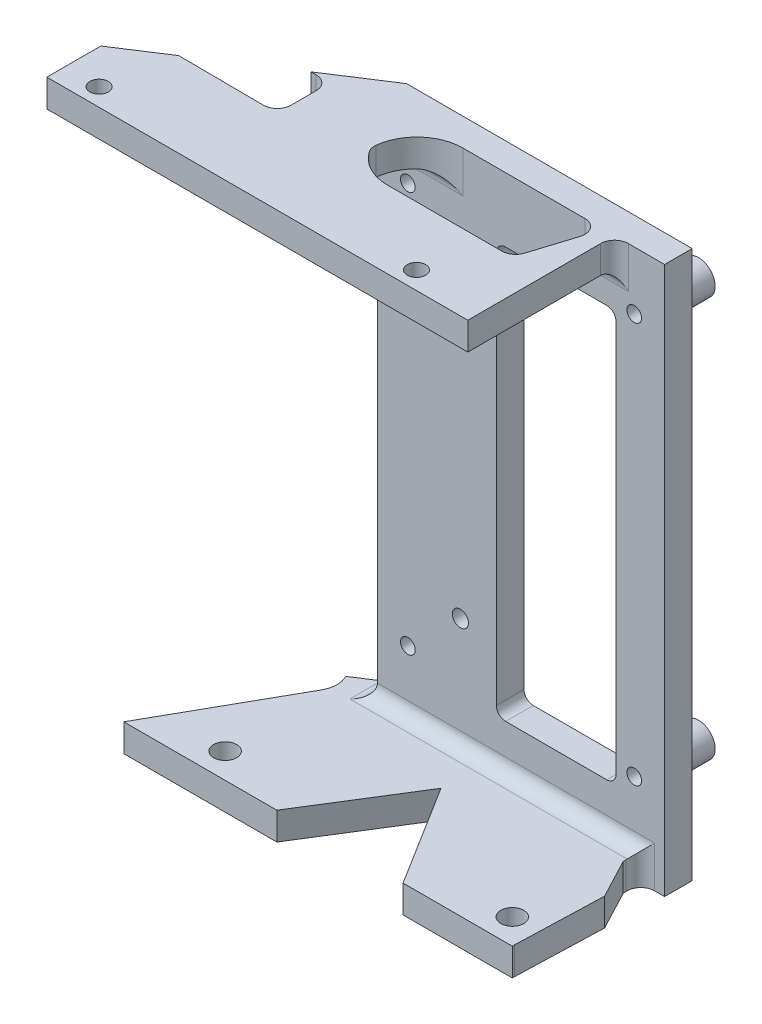
from build123d import *
from build123d.topology import SkipClean

# Parameters (mm, degrees)
SKETCH_1_R               = 3.6
SKETCH_1_R_2             = 1.6
EXTRUDE_1_DEPTH          = 3
EXTRUDE_1_2_DEPTH        = 3
EXTRUDE_1_3_DEPTH        = 3
EXTRUDE_1_4_DEPTH        = 3
EXTRUDE_1_5_DEPTH        = 3
SKETCH_2_R               = 1.6
EXTRUDE_2_DEPTH          = 6
CUT_EXTRUDE_START        = -5
CUT_EXTRUDE_1_DEPTH      = 5
EXTRUDE_START            = -6
EXTRUDE_3_DEPTH          = 6
SKETCH_12_R              = 2.5
EXTRUDE_4_DEPTH          = 6
SKETCH_13_R              = 2
EXTRUDE_5_DEPTH          = 6
SKETCH_15_W              = 58.485860782
SKETCH_15_H              = 6
EXTRUDE_7_DEPTH          = 40
SKETCH_16_R              = 2
CUT_EXTRUDE_5_DEPTH      = 40
FILLET_1_R               = 5
CUT_EXTRUDE_6_DEPTH      = 40
SKETCH_21_W              = 57.375860782
SKETCH_21_H              = 6
EXTRUDE_8_DEPTH          = 40
CUT_EXTRUDE_7_DEPTH      = 12
CUT_EXTRUDE_7_DEPTH_BACK = 26
SKETCH_24_R              = 2.5
SKETCH_25_W              = 118.615869392
SKETCH_25_H              = 27.10726564
CUT_EXTRUDE_9_DEPTH      = 130
SKETCH_26_W              = 3
SKETCH_26_H              = 7.2
CUT_EXTRUDE_10_DEPTH     = 13
CUT_EXTRUDE_11_DEPTH     = 153
EXTRUDE_9_DEPTH          = 5.999999993
CUT_EXTRUDE_12_DEPTH     = 10
EXTRUDE_START_2          = 5
SKETCH_30_R              = 3.6
SKETCH_30_R_2            = 1.6
EXTRUDE_10_DEPTH         = 5
SKETCH_31_W              = 78.686898171
SKETCH_31_H              = 6
SKETCH_31_W_2            = 101.17730892
EXTRUDE_11_DEPTH         = 15
SKETCH_32_R              = 2.5
CUT_EXTRUDE_13_DEPTH     = 15
EXTRUDE_12_DEPTH         = 3
SKETCH_35_R              = 2
CUT_EXTRUDE_14_DEPTH     = 23
SKETCH_37_W              = 101.17730892
SKETCH_37_H              = 6
SKETCH_37_W_2            = 81.686898171
EXTRUDE_13_DEPTH         = 3
CUT_EXTRUDE_15_DEPTH     = 13
CUT_EXTRUDE_16_DEPTH     = 13
CUT_EXTRUDE_17_DEPTH     = 13
CUT_EXTRUDE_18_DEPTH     = 13
SKETCH_44_R              = 1.6
EXTRUDE_14_DEPTH         = 6
SKETCH_45_R              = 1.6
EXTRUDE_15_DEPTH         = 6
SKETCH_46_R              = 1.75
CUT_EXTRUDE_20_DEPTH     = 10
CUT_EXTRUDE_21_DEPTH     = 8
SKETCH_50_W              = 128.22859335
SKETCH_50_H              = 38.015550961
CUT_EXTRUDE_22_DEPTH     = 279
SKETCH_51_W              = 42.099918758
SKETCH_51_H              = 15.171022686
CUT_EXTRUDE_26_DEPTH     = 13
CUT_EXTRUDE_27_DEPTH     = 13
FILLET_2_R               = 10
FILLET_3_R               = 10
FILLET_4_R               = 3
EXTRUDE_16_DEPTH         = 5.999999993
FILLET_5_R               = 3
FILLET_6_R               = 3
FILLET_7_R               = 3


with BuildPart() as part:
    # 草图1 → 凸台-拉伸1 (new body)
    with BuildSketch(Plane.XY):
        with Locations((-17.87, 46.890036)):
            Circle(SKETCH_1_R)
        with Locations((-17.87, 46.890036)):
            Circle(SKETCH_1_R_2, mode=Mode.SUBTRACT)
    extrude(amount=EXTRUDE_1_DEPTH)



with BuildPart() as body_2:
    # 草图1 → Extrude 1 2 (new body)
    with BuildSketch(Plane.XY):
        with Locations((31.338126, 46.890036)):
            Circle(SKETCH_1_R)
        with Locations((31.338126, 46.890036)):
            Circle(SKETCH_1_R_2, mode=Mode.SUBTRACT)
    extrude(amount=EXTRUDE_1_2_DEPTH)


with BuildPart() as body_3:
    # 草图1 → Extrude 1 3 (new body)
    with BuildSketch(Plane.XY):
        with Locations((29.0930015, 5.590791)):
            Circle(SKETCH_1_R)
        with Locations((29.0930015, 5.590791)):
            Circle(SKETCH_1_R_2, mode=Mode.SUBTRACT)
    extrude(amount=EXTRUDE_1_3_DEPTH)


with BuildPart() as body_4:
    # 草图1 → Extrude 1 4 (new body)
    with BuildSketch(Plane.XY):
        with Locations((31.338088, -40.19405)):
            Circle(SKETCH_1_R)
        with Locations((31.338088, -40.19405)):
            Circle(SKETCH_1_R_2, mode=Mode.SUBTRACT)
    extrude(amount=EXTRUDE_1_4_DEPTH)


with BuildPart() as body_5:
    # 草图1 → Extrude 1 5 (new body)
    with BuildSketch(Plane.XY):
        with BuildLine():
            Line((-17.66382396, -32.616834919), (-20.99040196, -38.398752919))
            ThreePointArc((-20.99040196, -38.398752919), (-19.665297081, -43.31445196), (-14.74959804, -41.989347081))
            Line((-14.74959804, -41.989347081), (-11.42302004, -36.207429081))
            ThreePointArc((-11.42302004, -36.207429081), (-12.748124919, -31.29173004), (-17.66382396, -32.616834919))
        make_face()
        with Locations((-14.543422, -34.412132)):
            Circle(SKETCH_1_R_2, mode=Mode.SUBTRACT)
        with Locations((-17.87, -40.19405)):
            Circle(SKETCH_1_R_2, mode=Mode.SUBTRACT)
    extrude(amount=EXTRUDE_1_5_DEPTH)


with BuildPart() as part_1:
    add(part.part)

    add(body_2.part)  # 凸台-拉伸2 merges body 2

    add(body_3.part)  # 凸台-拉伸2 merges body 3

    add(body_4.part)  # 凸台-拉伸2 merges body 4

    add(body_5.part)  # 凸台-拉伸2 merges body 5
    # 草图2 → 凸台-拉伸2 (add)
    with BuildSketch(Plane.XY.offset(3)):
        with BuildLine():
            Line((-17.87, -46.79405), (31.338088, -46.79405))
            ThreePointArc((31.338088, -46.79405), (36.004991738, -44.860955774), (37.938088, -40.19405288))
            Line((37.938088, -40.19405288), (37.938126, 46.89003312))
            ThreePointArc((37.938126, 46.89003312), (36.005031774, 51.556939738), (31.338126, 53.490036))
            Line((31.338126, 53.490036), (-17.87, 53.490036))
            ThreePointArc((-17.87, 53.490036), (-22.536904756, 51.556940756), (-24.47, 46.890036))
            Line((-24.47, 46.890036), (-24.47, -40.19405))
            ThreePointArc((-24.47, -40.19405), (-22.536904756, -44.860954756), (-17.87, -46.79405))
        make_face()
        with Locations((-14.543422, -34.412132)):
            Circle(SKETCH_2_R, mode=Mode.SUBTRACT)
        with Locations((-17.87, -40.19405)):
            Circle(SKETCH_2_R, mode=Mode.SUBTRACT)
        with Locations((31.338088, -40.19405)):
            Circle(SKETCH_2_R, mode=Mode.SUBTRACT)
        with Locations((29.0930015, 5.590791)):
            Circle(SKETCH_2_R, mode=Mode.SUBTRACT)
        with Locations((31.338126, 46.890036)):
            Circle(SKETCH_2_R, mode=Mode.SUBTRACT)
        with Locations((-17.87, 46.890036)):
            Circle(SKETCH_2_R, mode=Mode.SUBTRACT)
        with BuildLine():
            Line((25.375000001, 45.5), (3.375000001, 45.5))
            ThreePointArc((3.375000001, 45.5), (1.960786438, 44.914213562), (1.375000001, 43.5))
            Line((1.375000001, 43.5), (1.375000001, -41.79405))
            ThreePointArc((1.375000001, -41.79405), (1.960786438, -43.208263562), (3.375000001, -43.79405))
            Line((3.375000001, -43.79405), (25.375000001, -43.79405))
            ThreePointArc((25.375000001, -43.79405), (26.789213563, -43.208263562), (27.375000001, -41.79405))
            Line((27.375000001, -41.79405), (27.375000001, 43.5))
            ThreePointArc((27.375000001, 43.5), (26.789213563, 44.914213562), (25.375000001, 45.5))
        make_face(mode=Mode.SUBTRACT)
    extrude(amount=EXTRUDE_2_DEPTH)

    # 草图3 → 切除-拉伸1 (cut)
    with BuildSketch(Plane.XY.offset(3).offset(CUT_EXTRUDE_START)):
        with BuildLine():
            Line((27.375000001, 2.427174265), (27.375000001, 8.754407735))
            ThreePointArc((27.375000001, 8.754407735), (25.4930015, 5.590791), (27.375000001, 2.427174265))
        make_face()
    extrude(amount=CUT_EXTRUDE_1_DEPTH, mode=Mode.SUBTRACT)

    # 草图10 → 凸台-拉伸3 (add)
    with BuildSketch(Plane.XY.offset(9).offset(EXTRUDE_START)):
        with BuildLine():
            Line((-24.47, 59.499999998), (-24.47, 46.890036))
            ThreePointArc((-24.47, 46.890036), (-22.536904756, 51.556940756), (-17.87, 53.490036))
            Line((-17.87, 53.490036), (31.338126, 53.490036))
            ThreePointArc((31.338126, 53.490036), (36.005031774, 51.556939738), (37.938126, 46.89003312))
            Line((37.938126, 46.89003312), (37.938131502, 59.499999998))
            Line((37.938131502, 59.499999998), (-24.47, 59.499999998))
        make_face()
        with BuildLine():
            Line((37.938079576, -59.500000002), (37.938088, -40.19405288))
            ThreePointArc((37.938088, -40.19405288), (36.004991738, -44.860955774), (31.338088, -46.79405))
            Line((31.338088, -46.79405), (-17.87, -46.79405))
            ThreePointArc((-17.87, -46.79405), (-22.536904756, -44.860954756), (-24.47, -40.19405))
            Line((-24.47, -40.19405), (-24.47, -59.500000002))
            Line((-24.47, -59.500000002), (37.938079576, -59.500000002))
        make_face()
    extrude(amount=EXTRUDE_3_DEPTH)

    # 草图12 → 凸台-拉伸4 (add)
    with BuildSketch(Plane(origin=(0, -59.500000002, 0), x_dir=(1, 0, 0), z_dir=(0, 1, 0))):
        with BuildLine():
            Line((-31.210634294, -60.375860782), (31.210634294, -60.375860782))
            ThreePointArc((31.210634294, -60.375860782), (34.687498708, -58.969106369), (36.207925379, -55.540426322))
            Line((36.207925379, -55.540426322), (37.938131503, -3))
            Line((37.938131503, -3), (-24.47, -3))
            Line((-24.47, -3), (-36.087026477, -54.270962924))
            ThreePointArc((-36.087026477, -54.270962924), (-35.117326584, -58.496398453), (-31.210634294, -60.375860782))
        make_face()
        with Locations(Location((31.210634294, -55.375860782, 0), (0, 0, 180))):
            Circle(SKETCH_12_R, mode=Mode.SUBTRACT)
        with Locations(Location((-31.210634294, -55.375860782, 0), (0, 0, 180))):
            Circle(SKETCH_12_R, mode=Mode.SUBTRACT)
    extrude(amount=EXTRUDE_4_DEPTH)

    # 草图13 → 凸台-拉伸5 (add)
    with BuildSketch(Plane.XZ.offset(-59.500000005)):
        with BuildLine():
            Line((-57, 61.485860782), (12, 61.485860782))
            ThreePointArc((12, 61.485860782), (14.537354997, 60.702287778), (16.191064272, 58.624451722))
            Line((16.191064272, 58.624451722), (37.938079576, 3.00157684))
            Line((37.938079576, 3.00157684), (-24.47, 3))
            Line((-24.47, 3), (-60.678697485, 54.39410755))
            ThreePointArc((-60.678697485, 54.39410755), (-60.994551887, 59.057950362), (-57, 61.485860782))
        make_face()
        with Locations((-57, 56.985860782)):
            Circle(SKETCH_13_R, mode=Mode.SUBTRACT)
        with Locations((12, 56.985860782)):
            Circle(SKETCH_13_R, mode=Mode.SUBTRACT)
    extrude(amount=EXTRUDE_5_DEPTH)

    # 草图15 → 凸台-拉伸7 (add)
    with BuildSketch(Plane.ZY.offset(24.47)):
        with Locations((32.242930391, 56.500000005)):
            Rectangle(SKETCH_15_W, SKETCH_15_H)
    extrude(amount=EXTRUDE_7_DEPTH)

    # 草图16 → 切除-拉伸5 (cut)
    with BuildSketch(Plane(origin=(0, 59.499999998, 0), x_dir=(1, 0, 0), z_dir=(0, 1, 0))):
        with Locations(Location((-57, -56.985860782, 0), (0, 0, 270))):
            Circle(SKETCH_16_R)
    extrude(amount=-CUT_EXTRUDE_5_DEPTH, mode=Mode.SUBTRACT)

    # 圆角1
    fillet_1_edges = [part_1.edges().sort_by_distance(p)[0] for p in [
        (-64.47, 56.500000005, 61.485860782),
    ]]
    fillet(fillet_1_edges, radius=FILLET_1_R)

    # 草图18 → 切除-拉伸6 (cut)
    with BuildSketch(Plane(origin=(0, 59.499999998, 0), x_dir=(1, 0, 0), z_dir=(0, 1, 0))):
        with BuildLine():
            ThreePointArc((10, -36.985860782), (10.585786437, -38.400074344), (12, -38.985860782))
            Line((12, -38.985860782), (12, -36.985860782))
            Line((12, -36.985860782), (10, -36.985860782))
        make_face()
        with BuildLine():
            Line((12, -36.985860782), (12, -38.985860782))
            ThreePointArc((12, -38.985860782), (13.414213562, -38.400074344), (14, -36.985860782))
            ThreePointArc((14, -36.985860782), (12, -34.985860782), (10, -36.985860782))
            Line((10, -36.985860782), (12, -36.985860782))
        make_face()
        with BuildLine():
            ThreePointArc((-59, -36.985860782), (-57, -38.985860782), (-55, -36.985860782))
            Line((-55, -36.985860782), (-59, -36.985860782))
        make_face()
        with BuildLine():
            Line((-59, -36.985860782), (-55, -36.985860782))
            ThreePointArc((-55, -36.985860782), (-57, -34.985860782), (-59, -36.985860782))
        make_face()
    extrude(amount=-CUT_EXTRUDE_6_DEPTH, mode=Mode.SUBTRACT)

    # 草图21 → 凸台-拉伸8 (add)
    with BuildSketch(Plane.ZY.offset(24.47)):
        with Locations((31.687930391, -56.500000002)):
            Rectangle(SKETCH_21_W, SKETCH_21_H)
    extrude(amount=EXTRUDE_8_DEPTH)

    # 草图24 → 切除-拉伸7 (cut, two sides: drawn at the far end of the back side and taken through both)
    with BuildSketch(Plane.XZ.offset(59.500000002).offset(-CUT_EXTRUDE_7_DEPTH_BACK)):
        with Locations((31.210634294, 35.375860782)):
            Circle(SKETCH_24_R)
        with Locations((-31.210634294, 35.375860782)):
            Circle(SKETCH_24_R)
    extrude(amount=CUT_EXTRUDE_7_DEPTH + CUT_EXTRUDE_7_DEPTH_BACK, mode=Mode.SUBTRACT)

    # 草图25 → 切除-拉伸9 (cut)
    with BuildSketch(Plane.XZ.offset(59.500000002)):
        with Locations((-10.502271589, 53.929493602)):
            Rectangle(SKETCH_25_W, SKETCH_25_H)
    extrude(amount=-CUT_EXTRUDE_9_DEPTH, mode=Mode.SUBTRACT)

    # 草图26 → 切除-拉伸10 (cut)
    with BuildSketch(Plane(origin=(37.938105539, -1.6555e-05, 0), x_dir=(0, 0, -1), z_dir=(0.9999999999999049, -4.3635986488750117e-07, 0))):
        with Locations((-1.5, 5.590803695)):
            Rectangle(SKETCH_26_W, SKETCH_26_H)
    extrude(amount=-CUT_EXTRUDE_10_DEPTH, mode=Mode.SUBTRACT)

    # 草图27 → 切除-拉伸11 (cut)
    with BuildSketch(Plane.XZ.offset(59.500000002)):
        Polygon((-64.47, 3), (-24.161392777, 3), (-64.47, 29.148665736), align=None)
    extrude(amount=-CUT_EXTRUDE_11_DEPTH, mode=Mode.SUBTRACT)

    # 草图28 → 凸台-拉伸9 (add)
    with BuildSketch(Plane(origin=(0, 59.499999998, 0), x_dir=(1, 0, 0), z_dir=(0, 1, 0))):
        Polygon((36.70730892, -40.375860782), (37.740545806, -9), (35.592860985, -9), (23.325761773, -40.375860782), align=None)
    extrude(amount=-EXTRUDE_9_DEPTH)

    # 草图29 → 切除-拉伸12 (cut)
    with BuildSketch(Plane.XZ.offset(-53.500000005)):
        Polygon((14.216898171, 40.375860782), (36.70730892, 40.375860782), (37.740545806, 9), (25.290680955, 9), align=None)
    extrude(amount=-CUT_EXTRUDE_12_DEPTH, mode=Mode.SUBTRACT)

    # 草图30 → 凸台-拉伸10 (add)
    # profile 1 of 4: a face of its own
    with SkipClean():  # the faces are left unmerged after this step: merging them gives an invalid solid
        with BuildSketch(Plane(origin=(0, 0, 0), x_dir=(-1, 0, 0), z_dir=(0, 0, -1)).offset(EXTRUDE_START_2)):
            with Locations((17.87, 46.890036)):
                Circle(SKETCH_30_R)
            with Locations((17.87, 46.890036)):
                Circle(SKETCH_30_R_2, mode=Mode.SUBTRACT)
        # profile 2 of 4: a face of its own
        with BuildSketch(Plane(origin=(0, 0, 0), x_dir=(-1, 0, 0), z_dir=(0, 0, -1)).offset(EXTRUDE_START_2)):
            with Locations((-31.338126, 46.890036)):
                Circle(SKETCH_30_R)
            with Locations((-31.338126, 46.890036)):
                Circle(SKETCH_30_R_2, mode=Mode.SUBTRACT)
        # profile 3 of 4: a face of its own
        with BuildSketch(Plane(origin=(0, 0, 0), x_dir=(-1, 0, 0), z_dir=(0, 0, -1)).offset(EXTRUDE_START_2)):
            with Locations((-31.338088, -40.19405)):
                Circle(SKETCH_30_R)
            with Locations((-31.338088, -40.19405)):
                Circle(SKETCH_30_R_2, mode=Mode.SUBTRACT)
        # profile 4 of 4: a face of its own
        with BuildSketch(Plane(origin=(0, 0, 0), x_dir=(-1, 0, 0), z_dir=(0, 0, -1)).offset(EXTRUDE_START_2)):
            with BuildLine():
                Line((17.66382396, -32.616834919), (20.99040196, -38.398752919))
                ThreePointArc((20.99040196, -38.398752919), (19.665297081, -43.31445196), (14.74959804, -41.989347081))
                Line((14.74959804, -41.989347081), (11.42302004, -36.207429081))
                ThreePointArc((11.42302004, -36.207429081), (12.748124919, -31.29173004), (17.66382396, -32.616834919))
            make_face()
            with Locations((17.87, -40.19405)):
                Circle(SKETCH_30_R_2, mode=Mode.SUBTRACT)
            with Locations((14.543422, -34.412132)):
                Circle(SKETCH_30_R_2, mode=Mode.SUBTRACT)
        extrude(amount=-EXTRUDE_10_DEPTH)

    # 草图31 → 凸台-拉伸11 (add)
    with SkipClean():  # the faces are left unmerged after this step: merging them gives an invalid solid
        with BuildSketch(Plane.XY.offset(40.375860782)):
            with Locations((-25.126550915, 56.500000005)):
                Rectangle(SKETCH_31_W, SKETCH_31_H)
            with Locations((-13.88134554, -56.500000002)):
                Rectangle(SKETCH_31_W_2, SKETCH_31_H)
        extrude(amount=EXTRUDE_11_DEPTH)

    # 草图32 → 切除-拉伸13 (cut)
    with SkipClean():  # the faces are left unmerged after this step: merging them gives an invalid solid
        with BuildSketch(Plane.XZ.offset(59.500000002)):
            with Locations((31.210634294, 35.375860782)):
                Circle(SKETCH_32_R)
            with Locations((-31.210634294, 35.375860782)):
                Circle(SKETCH_32_R)
            with Locations((31.210634294, 51.375860782)):
                Circle(SKETCH_32_R)
            with Locations((-31.210634294, 51.375860782)):
                Circle(SKETCH_32_R)
        extrude(amount=-CUT_EXTRUDE_13_DEPTH, mode=Mode.SUBTRACT)

    # 草图34 → 凸台-拉伸12 (add)
    with SkipClean():  # the faces are left unmerged after this step: merging them gives an invalid solid
        with BuildSketch(Plane(origin=(14.216898171, 0, 0), x_dir=(0, 0, -1), z_dir=(1, 0, 0))):
            Polygon((-9, 59.499999998), (-40.375860782, 59.500000005), (-55.375860782, 59.500000005), (-55.375860782, 53.500000005), (-40.375860782, 53.500000005), (-9, 53.500000005), align=None)
        extrude(amount=EXTRUDE_12_DEPTH)
    add(part_1.part.scale(1), mode=Mode.REPLACE)  # the faces are merged on a copy

    # 草图35 → 切除-拉伸14 (cut)
    with BuildSketch(Plane(origin=(0, 59.499999998, 0), x_dir=(1, 0, 0), z_dir=(0, 1, 0))):
        with Locations(Location((12, -36.985860782, 0), (0, 0, 270))):
            Circle(SKETCH_35_R)
        with Locations(Location((-57, -36.985860782, 0), (0, 0, 270))):
            Circle(SKETCH_35_R)
        with Locations(Location((-57, -52.985860782, 0), (0, 0, 270))):
            Circle(SKETCH_35_R)
        with Locations(Location((12, -52.985860782, 0), (0, 0, 270))):
            Circle(SKETCH_35_R)
    extrude(amount=-CUT_EXTRUDE_14_DEPTH, mode=Mode.SUBTRACT)

    # 草图37 → 凸台-拉伸13 (add)
    with BuildSketch(Plane.XY.offset(55.375860782)):
        with Locations((-13.88134554, -56.500000002)):
            Rectangle(SKETCH_37_W, SKETCH_37_H)
        with Locations((-23.626550915, 56.500000005)):
            Rectangle(SKETCH_37_W_2, SKETCH_37_H)
    extrude(amount=EXTRUDE_13_DEPTH)

    # 草图39 → 切除-拉伸15 (cut)
    with BuildSketch(Plane.XZ.offset(59.500000002)):
        with BuildLine():
            Line((-32.281825134, 13.408267167), (-57.605939842, 58.375860782))
            Line((-57.605939842, 58.375860782), (-64.47, 58.375860782))
            Line((-64.47, 58.375860782), (-64.47, 29.148665736))
            Line((-64.47, 29.148665736), (-32.171689656, 8.196373429))
            ThreePointArc((-32.171689656, 8.196373429), (-31.569826577, 10.805388922), (-32.271215267, 13.38942741))
            Line((-32.271215267, 13.38942741), (-32.281825134, 13.408267167))
        make_face()
    extrude(amount=-CUT_EXTRUDE_15_DEPTH, mode=Mode.SUBTRACT)

    # 草图40 → 切除-拉伸16 (cut)
    with BuildSketch(Plane.XZ.offset(59.500000002)):
        with BuildLine():
            Line((13.490514871, 59.643765057), (4.797601505, 44.136696863))
            ThreePointArc((4.797601505, 44.136696863), (0, 41.326124273), (-4.797601506, 44.136696863))
            Line((-4.797601506, 44.136696863), (-13.47016018, 59.607454838))
            Line((-13.47016018, 59.607454838), (13.490514871, 59.643765057))
        make_face()
    extrude(amount=-CUT_EXTRUDE_16_DEPTH, mode=Mode.SUBTRACT)

    # 草图41 → 切除-拉伸17 (cut)
    with BuildSketch(Plane.XZ.offset(59.500000002)):
        with BuildLine():
            Line((37.331197575, 21.430501938), (32.842963583, 12.931674733))
            ThreePointArc((32.842963583, 12.931674733), (34.801392882, 14.906779789), (37.527916252, 15.456830348))
            Line((37.527916252, 15.456830348), (37.331197575, 21.430501938))
        make_face()
    extrude(amount=-CUT_EXTRUDE_17_DEPTH, mode=Mode.SUBTRACT)

    # 草图42 → 切除-拉伸18 (cut)
    with BuildSketch(Plane.XZ.offset(59.500000002)):
        with BuildLine():
            Line((37.938079576, 9), (37.527916252, 15.456830348))
            ThreePointArc((37.527916252, 15.456830348), (34.801392882, 14.906779789), (32.842963583, 12.931674733))
            Line((32.842963583, 12.931674733), (32.557039267, 9))
            Line((32.557039267, 9), (37.938079576, 9))
        make_face()
    extrude(amount=-CUT_EXTRUDE_18_DEPTH, mode=Mode.SUBTRACT)

    # 草图44 → 凸台-拉伸14 (add)
    with BuildSketch(Plane.XY.offset(9).offset(EXTRUDE_START)):
        with Locations((29.0930015, 5.590791)):
            Circle(SKETCH_44_R)
    extrude(amount=EXTRUDE_14_DEPTH)

    # 草图45 → 凸台-拉伸15 (add)
    with BuildSketch(Plane.XY.offset(9).offset(EXTRUDE_START)):
        with Locations(Location((-14.543422, -34.412132, 0), (0, 0, 180))):
            Circle(SKETCH_45_R)
    extrude(amount=EXTRUDE_15_DEPTH)

    # 草图46 → 切除-拉伸20 (cut)
    with BuildSketch(Plane.XY.offset(9)):
        with Locations((-6.446149988, -29.338492008)):
            Circle(SKETCH_46_R)
        with Locations((-6.446149988, 36.034478008)):
            Circle(SKETCH_46_R)
    extrude(amount=-CUT_EXTRUDE_20_DEPTH, mode=Mode.SUBTRACT)

    # 草图47 → 切除-拉伸21 (cut)
    with BuildSketch(Plane(origin=(0, 0, -5), x_dir=(-1, 0, 0), z_dir=(0, 0, -1))):
        with BuildLine():
            Line((20.99040196, -38.398752919), (17.66382396, -32.616834919))
            ThreePointArc((17.66382396, -32.616834919), (12.748124919, -31.29173004), (11.42302004, -36.207429081))
            Line((11.42302004, -36.207429081), (14.74959804, -41.989347081))
            ThreePointArc((14.74959804, -41.989347081), (16.074702919, -37.07364804), (20.99040196, -38.398752919))
        make_face()
    extrude(amount=-CUT_EXTRUDE_21_DEPTH, mode=Mode.SUBTRACT)

    # 草图50 → 切除-拉伸22 (cut)
    with BuildSketch(Plane.XZ.offset(59.500000002)):
        with Locations((-21.364296676, 59.883636263)):
            Rectangle(SKETCH_50_W, SKETCH_50_H)
    extrude(amount=-CUT_EXTRUDE_22_DEPTH, mode=Mode.SUBTRACT)

    # 草图51 → 切除-拉伸26 (cut)
    with BuildSketch(Plane(origin=(0, 59.499999998, 0), x_dir=(1, 0, 0), z_dir=(0, 1, 0))):
        Polygon((-32.646514645, -11.164466094), (-32.646514645, -22.637803205), (-54.199174306, -22.485860782), (-42.560467355, -11.164466094), align=None)
        with Locations((5.124763669, -16.585511343)):
            Rectangle(SKETCH_51_W, SKETCH_51_H)
    extrude(amount=-CUT_EXTRUDE_26_DEPTH, mode=Mode.SUBTRACT)

    # 草图52 → 切除-拉伸27 (cut)
    with BuildSketch(Plane.XZ.offset(59.500000002)):
        Polygon((12.956316985, 40.875860782), (-14.470547832, 40.875860782), (-0.757115424, 18.897177868), align=None)
    extrude(amount=-CUT_EXTRUDE_27_DEPTH, mode=Mode.SUBTRACT)

    # 圆角2
    fillet_2_edges = [part_1.edges().sort_by_distance(p)[0] for p in [
        (-15.92519571, 56.500000002, 9),
    ]]
    fillet(fillet_2_edges, radius=FILLET_2_R)

    # 圆角3
    # the kernel refuses this fillet: 10 mm, written as the material it adds along each edge
    with BuildSketch(Plane(origin=(-15.92519571, 59.499999998, 24.171022686), x_dir=(0, 0, -1), z_dir=(0, -1, 0))) as fillet_3_piece_1:
        with BuildLine():
            CenterArc((10, 8.75676756), FILLET_3_R, 180, 61.125170932)
            Line((0, 8.75676756), (-0.2, 8.75676756))
            Line((-0.2, 8.75676756), (-0.2, 0))
            Line((-0.2, 0), (0, -0.2))
            ThreePointArc((0, -0.2), (2.585511343, -0.2), (5.07444314, -0.175135351))
            Line((5.07444314, -0.175135351), (5.171022686, 0))
        make_face()
    extrude(amount=5.999999993)

    # 圆角4
    fillet_4_edges = [part_1.edges().sort_by_distance(p)[0] for p in [
        (-15.92519571, 56.500000002, 19),
    ]]
    fillet(fillet_4_edges, radius=FILLET_4_R)

    # 草图53 → 凸台-拉伸16 (add)
    with BuildSketch(Plane(origin=(0, 59.499999998, 0), x_dir=(1, 0, 0), z_dir=(0, 1, 0))):
        Polygon((19.936226745, -24.171022686), (24.701780293, -9), (27.044499099, -9), (27.044499099, -40.875860782), (17.216898171, -40.875860782), (17.216898171, -31.87582207), align=None)
    extrude(amount=-EXTRUDE_16_DEPTH)

    # 圆角5
    fillet_5_edges = [part_1.edges().sort_by_distance(p)[0] for p in [
        (24.701780293, 56.500000002, 9),
        (19.936226745, 56.500000002, 24.171022686),
    ]]
    fillet(fillet_5_edges, radius=FILLET_5_R)

    # 圆角6
    fillet_6_edges = [part_1.edges().sort_by_distance(p)[0] for p in [
        (-32.646514645, 56.500000002, 11.164466094),
        (-32.646514645, 56.500000002, 22.637803205),
    ]]
    fillet(fillet_6_edges, radius=FILLET_6_R)

    # 圆角7
    fillet_7_edges = [part_1.edges().sort_by_distance(p)[0] for p in [
        (27.044499099, 56.500000002, 9),
        (22.658333305, 53.500000005, 9),
        (-24.47, 53.500000005, 6.100098561),
        (-15.197597855, 53.500000005, 9),
        (-24.47, -53.500000002, 6.100098561),
        (4.043519634, -53.500000002, 9),
        (32.557039267, -56.500000002, 9),
    ]]
    fillet(fillet_7_edges, radius=FILLET_7_R)


solid = part_1.part
